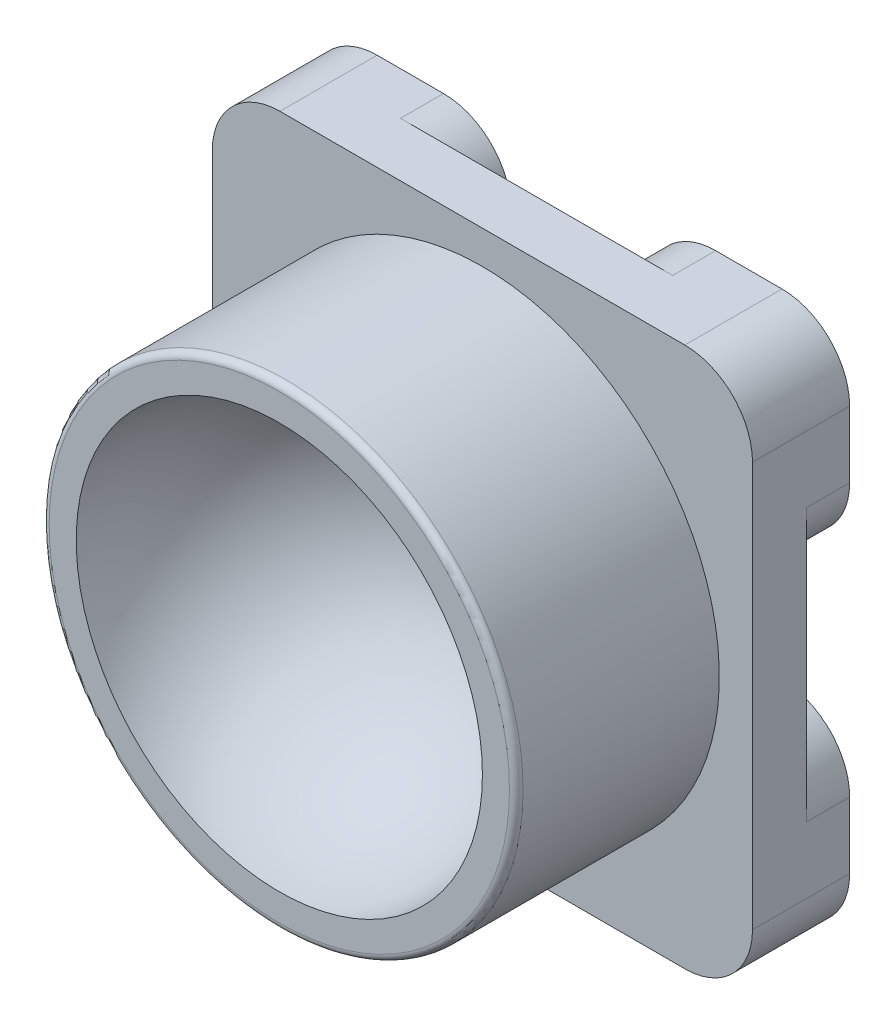
from build123d import *

# Parameters (mm, degrees)
SKETCH1_W             = 29.8
SKETCH1_H             = 29.8
BOSS_EXTRUDE1_DEPTH   = 6.35
BOSS_EXTRUDE1_2_DEPTH = 6.35
BOSS_EXTRUDE1_3_DEPTH = 6.35
BOSS_EXTRUDE1_4_DEPTH = 6.35
SKETCH2_W             = 79.8
SKETCH2_H             = 79.8
BOSS_EXTRUDE2_DEPTH   = 8
FILLET2_R             = 10
SKETCH3_R             = 35
SKETCH3_R_2           = 30
BOSS_EXTRUDE3_DEPTH   = 30
FILLET3_R             = 30
FILLET4_R             = 1
SKETCH4_R             = 2.125
CUT_EXTRUDE1_DEPTH    = 5
SKETCH6_R             = 5
CUT_EXTRUDE2_DEPTH    = 30
SKETCH7_R             = 1.75
CUT_EXTRUDE3_DEPTH    = 100.337908172
SKETCH8_R             = 3
CUT_EXTRUDE4_DEPTH    = 4


with BuildPart() as part:
    # Sketch1 → Boss-Extrude1 (new body)
    with BuildSketch(Plane.XY):
        Rectangle(SKETCH1_W, SKETCH1_H)
    extrude(amount=BOSS_EXTRUDE1_DEPTH)



with BuildPart() as body_2:
    # Sketch1 → Boss-Extrude1 2 (new body)
    with BuildSketch(Plane.XY):
        with Locations((50, 0)):
            Rectangle(SKETCH1_W, SKETCH1_H)
    extrude(amount=BOSS_EXTRUDE1_2_DEPTH)


with BuildPart() as body_3:
    # Sketch1 → Boss-Extrude1 3 (new body)
    with BuildSketch(Plane.XY):
        with Locations((50, 50)):
            Rectangle(SKETCH1_W, SKETCH1_H)
    extrude(amount=BOSS_EXTRUDE1_3_DEPTH)


with BuildPart() as body_4:
    # Sketch1 → Boss-Extrude1 4 (new body)
    with BuildSketch(Plane.XY):
        with Locations((0, 50)):
            Rectangle(SKETCH1_W, SKETCH1_H)
    extrude(amount=BOSS_EXTRUDE1_4_DEPTH)


with BuildPart() as part_1:
    add(part.part)

    add(body_2.part)  # Boss-Extrude2 merges body 2

    add(body_3.part)  # Boss-Extrude2 merges body 3

    add(body_4.part)  # Boss-Extrude2 merges body 4
    # Sketch2 → Boss-Extrude2 (add)
    with BuildSketch(Plane.XY.offset(6.35)):
        with Locations((25, 25)):
            Rectangle(SKETCH2_W, SKETCH2_H)
    extrude(amount=BOSS_EXTRUDE2_DEPTH)

    # Fillet2
    fillet2_edges = [part_1.edges().sort_by_distance(p)[0] for p in [
        (-14.9, 64.9, 7.175),
        (64.9, -14.9, 7.175),
        (64.9, 64.9, 7.175),
        (35.1, 14.9, 3.175),
        (35.1, -14.9, 3.175),
        (64.9, 14.9, 3.175),
        (35.1, 64.9, 3.175),
        (35.1, 35.1, 3.175),
        (64.9, 35.1, 3.175),
        (-14.9, 35.1, 3.175),
        (14.9, 35.1, 3.175),
        (14.9, 64.9, 3.175),
        (-14.9, 14.9, 3.175),
        (14.9, 14.9, 3.175),
        (14.9, -14.9, 3.175),
        (-14.9, -14.9, 7.175),
    ]]
    fillet(fillet2_edges, radius=FILLET2_R)

    # Sketch3 → Boss-Extrude3 (add)
    with BuildSketch(Plane.XY.offset(14.35)):
        with Locations(Location((25, 25, 0), (0, 0, 180))):
            Circle(SKETCH3_R)
        with Locations((25, 25)):
            Circle(SKETCH3_R_2, mode=Mode.SUBTRACT)
    extrude(amount=BOSS_EXTRUDE3_DEPTH)

    # Fillet3
    fillet3_edges = [part_1.edges().sort_by_distance(p)[0] for p in [
        (-5, 25, 14.35),
    ]]
    fillet(fillet3_edges, radius=FILLET3_R - 0.0001)  # a hair under: the kernel refuses the full size

    # Fillet4
    fillet4_edges = [part_1.edges().sort_by_distance(p)[0] for p in [
        (60, 25, 44.35),
    ]]
    fillet(fillet4_edges, radius=FILLET4_R)

    # Sketch4 → Cut-Extrude1 (cut)
    with BuildSketch(Plane(origin=(0, 0, 0), x_dir=(-1, 0, 0), z_dir=(0, 0, -1))):
        with Locations((0, 50)):
            Circle(SKETCH4_R)
        Circle(SKETCH4_R)
        with Locations((-50, 0)):
            Circle(SKETCH4_R)
        with Locations((-50, 50)):
            Circle(SKETCH4_R)
    extrude(amount=-CUT_EXTRUDE1_DEPTH, mode=Mode.SUBTRACT)

    # Sketch6 → Cut-Extrude2 (cut)
    with BuildSketch(Plane.XY.offset(44.35)):
        with Locations((25, 25)):
            Circle(SKETCH6_R)
    extrude(amount=-CUT_EXTRUDE2_DEPTH, mode=Mode.SUBTRACT)

    # Sketch7 → Cut-Extrude3 (cut, through all)
    with BuildSketch(Plane(origin=(0, 0, 6.35), x_dir=(-1, 0, 0), z_dir=(0, 0, -1))):
        with Locations((-25, 25)):
            Circle(SKETCH7_R)
    extrude(amount=-CUT_EXTRUDE3_DEPTH, mode=Mode.SUBTRACT)

    # Sketch8 → Cut-Extrude4 (cut)
    with BuildSketch(Plane(origin=(0, 0, 6.35), x_dir=(-1, 0, 0), z_dir=(0, 0, -1))):
        with Locations((-25, 25)):
            Circle(SKETCH8_R)
    extrude(amount=-CUT_EXTRUDE4_DEPTH, mode=Mode.SUBTRACT)


solid = part_1.part
